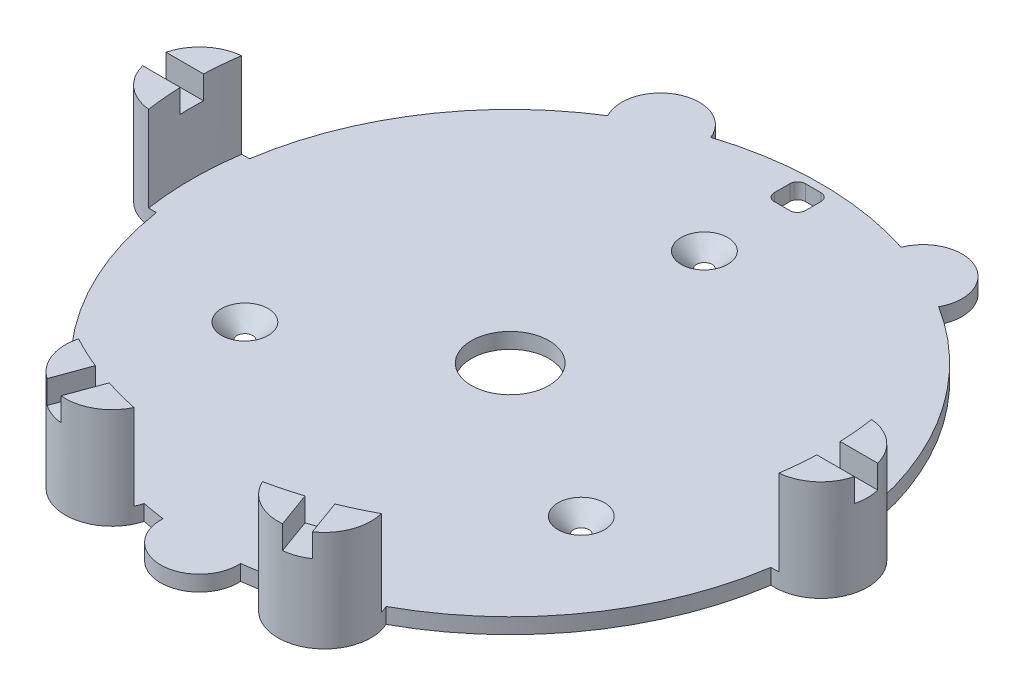
from build123d import *

# Parameters (mm, degrees)
SKETCH1_R           = 40
SKETCH1_R_2         = 5
SKETCH1_R_3         = 1
BOSS_EXTRUDE1_DEPTH = 2
CUT_EXTRUDE1_REACH  = 58.604
SKETCH6_R           = 6
BOSS_EXTRUDE4_DEPTH = 13
SKETCH9_R           = 41
CUT_EXTRUDE2_DEPTH  = 11
CUT_EXTRUDE3_DEPTH  = 3
CHAMFER1_SIZE       = 2
SKETCH11_R          = 5
BOSS_EXTRUDE5_DEPTH = 2


with BuildPart() as part:
    # Sketch1 → Boss-Extrude1 (new body)
    with BuildSketch(Plane(origin=(0, 0, 0), x_dir=(1, 0, 0), z_dir=(0, 1, 0))):
        with Locations(Location((0, 0, 0), (0, 0, 270))):
            Circle(SKETCH1_R)
        with Locations(Location((0, 0, 0), (0, 0, 270))):
            Circle(SKETCH1_R_2, mode=Mode.SUBTRACT)
        with Locations(Location((0, 25, 0), (0, 0, 270))):
            Circle(SKETCH1_R_3, mode=Mode.SUBTRACT)
        with Locations(Location((21.650635095, -12.5, 0), (0, 0, 270))):
            Circle(SKETCH1_R_3, mode=Mode.SUBTRACT)
        with Locations(Location((-21.650635095, -12.5, 0), (0, 0, 270))):
            Circle(SKETCH1_R_3, mode=Mode.SUBTRACT)
    extrude(amount=BOSS_EXTRUDE1_DEPTH)

    # Sketch2 → Cut-Extrude1 (cut, up to next)
    with BuildSketch(Plane(origin=(0, 2, 0), x_dir=(1, 0, 0), z_dir=(0, 1, 0)), mode=Mode.PRIVATE) as cut_extrude1_sk1:
        with BuildLine():
            Line((-1, 35), (1, 35))
            ThreePointArc((1, 35), (1.707106781, 35.292893219), (2, 36))
            Line((2, 36), (2, 38))
            ThreePointArc((2, 38), (1.707106781, 38.707106781), (1, 39))
            Line((1, 39), (-1, 39))
            ThreePointArc((-1, 39), (-1.707106781, 38.707106781), (-2, 38))
            Line((-2, 38), (-2, 36))
            ThreePointArc((-2, 36), (-1.707106781, 35.292893219), (-1, 35))
        make_face()
    cut_extrude1_tool1 = extrude(cut_extrude1_sk1.sketch, amount=-CUT_EXTRUDE1_REACH, mode=Mode.PRIVATE) & part.part
    add(cut_extrude1_tool1.solids().sort_by_distance((0, 2, -37))[0], mode=Mode.SUBTRACT)

    # Sketch6 → Boss-Extrude4 (add)
    with BuildSketch(Plane.XZ):
        with Locations(Location((13.680805733, 37.587704831, 0), (0, 0, 270))):
            Circle(SKETCH6_R)
        with Locations(Location((40, 0, 0), (0, 0, 270))):
            Circle(SKETCH6_R)
    boss_extrude4 = extrude(amount=-BOSS_EXTRUDE4_DEPTH)

    # Sketch9 → Cut-Extrude2 (cut)
    with BuildSketch(Plane(origin=(0, 13, 0), x_dir=(1, 0, 0), z_dir=(0, 1, 0))):
        Circle(SKETCH9_R)
    cut_extrude2 = extrude(amount=-CUT_EXTRUDE2_DEPTH, mode=Mode.SUBTRACT)

    # Sketch10 → Cut-Extrude3 (cut)
    with BuildSketch(Plane(origin=(0, 13, 0), x_dir=(1, 0, 0), z_dir=(0, 1, 0))):
        with BuildLine():
            Line((40.972551788, 1.5), (45.809475019, 1.5))
            ThreePointArc((45.809475019, 1.5), (46, 0), (45.809475019, -1.5))
            Line((45.809475019, -1.5), (40.972551788, -1.5))
            ThreePointArc((40.972551788, -1.5), (41, 0), (40.972551788, 1.5))
        make_face()
        with BuildLine():
            Line((15.422976966, -37.988574355), (17.077302143, -42.533795423))
            ThreePointArc((17.077302143, -42.533795423), (15.732926593, -43.225860556), (14.258224281, -43.559855853))
            Line((14.258224281, -43.559855853), (12.603899104, -39.014634785))
            ThreePointArc((12.603899104, -39.014634785), (14.022825876, -38.527397452), (15.422976966, -37.988574355))
        make_face()
    cut_extrude3 = extrude(amount=-CUT_EXTRUDE3_DEPTH, mode=Mode.SUBTRACT)

    # Mirror2: Boss-Extrude4, Cut-Extrude2, Cut-Extrude3 across plane
    add(boss_extrude4.mirror(Plane(origin=(0, 0, 0), x_dir=(0, 0, 1), z_dir=(1, 0, 0))))
    add(cut_extrude2.mirror(Plane(origin=(0, 0, 0), x_dir=(0, 0, 1), z_dir=(1, 0, 0))), mode=Mode.SUBTRACT)
    add(cut_extrude3.mirror(Plane(origin=(0, 0, 0), x_dir=(0, 0, 1), z_dir=(1, 0, 0))), mode=Mode.SUBTRACT)

    # Chamfer1
    chamfer1_edges = [part.edges().sort_by_distance(p)[0] for p in [
        (21.650635095, 2, 11.5),
        (-21.650635095, 2, 11.5),
        (0, 2, -26),
    ]]
    chamfer(chamfer1_edges, length=CHAMFER1_SIZE - 0.0001)  # a hair under: the kernel refuses the full size

    # Sketch11 → Boss-Extrude5 (add)
    with BuildSketch(Plane.XZ):
        with Locations((0, 40)):
            Circle(SKETCH11_R)
        with Locations((16.90473047, -36.252311481)):
            Circle(SKETCH11_R)
        with Locations((-16.90473047, -36.252311481)):
            Circle(SKETCH11_R)
    extrude(amount=-BOSS_EXTRUDE5_DEPTH)


solid = part.part
